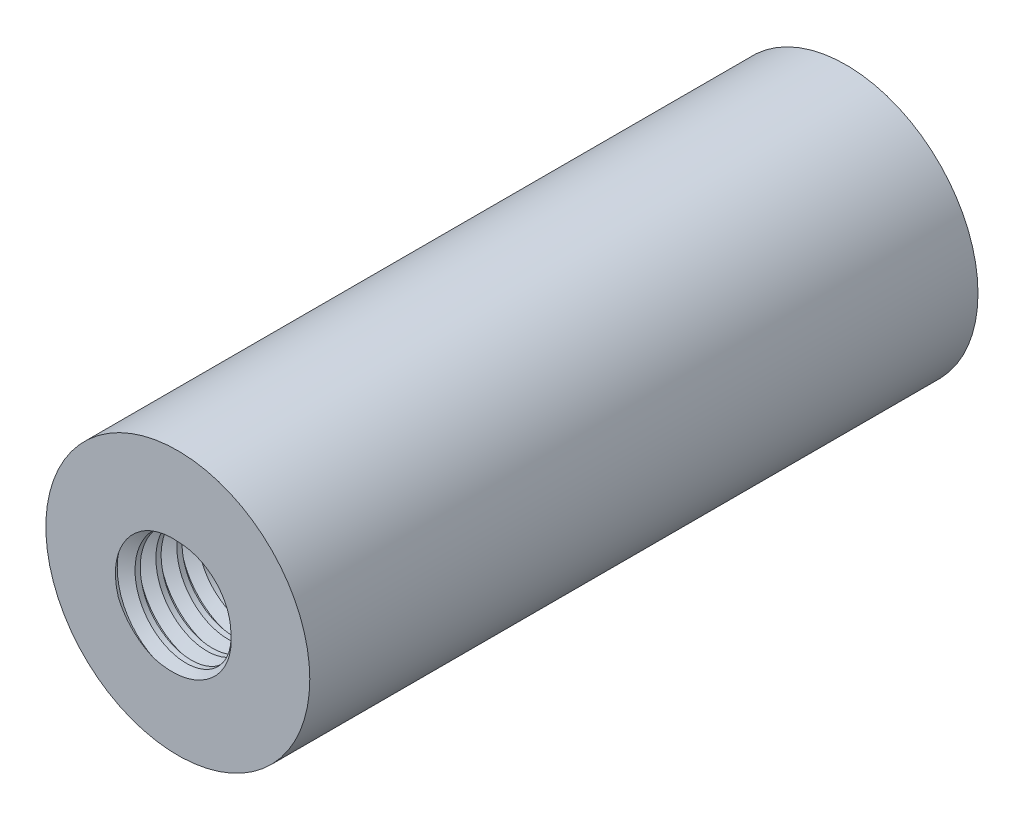
from build123d import *
from build123d.topology import SkipClean

# Parameters (mm, degrees)
SKETCH1_R           = 5.0165
BOSS_EXTRUDE1_DEPTH = 25.4
SKETCH2_R           = 2.0193
CUT_EXTRUDE1_DEPTH  = 27.372154719
THREAD1_PITCH       = 0.79375


with BuildPart() as part:
    # Sketch1 → Boss-Extrude1 (new body)
    with BuildSketch(Plane.XY):
        Circle(SKETCH1_R)
    extrude(amount=BOSS_EXTRUDE1_DEPTH)

    # Sketch2 → Cut-Extrude1 (cut, through all)
    with BuildSketch(Plane(origin=(0, 0, 0), x_dir=(-1, 0, 0), z_dir=(0, 0, -1))):
        Circle(SKETCH2_R)
    extrude(amount=-CUT_EXTRUDE1_DEPTH, mode=Mode.SUBTRACT)

    # Thread1: the profile of Thread Profile1 profile screwed along a right-hand helix of 32 turns, 8 arcs to a turn; built about Z, then put on its axis
    with SkipClean():  # the faces are left unmerged after this step: merging them gives an invalid solid
        thread1_z = Axis((0, 0, 0), (0, 0, 1))
        thread1_corners = [(2.019, 0, -0.000173205), (2.448929788, 0, 0.248046874), (2.448929788, 0, 0.347265624), (2.019, 0, 0.595485703)]
        with BuildLine(mode=Mode.PRIVATE) as thread1_profile:
            Line(thread1_corners[0], thread1_corners[1])
            Line(thread1_corners[1], thread1_corners[2])
            Line(thread1_corners[2], thread1_corners[3])
            Line(thread1_corners[3], thread1_corners[0])
        thread1_cap = Face(thread1_profile.wire())
        thread1_turn_angles = [0, 22.5, 45, 67.5, 90, 112.5, 135, 157.5, 180, 202.5, 225, 247.5, 270, 292.5, 315, 337.5, 360]
        thread1_turn_weights = [1, 0.9238795325112867, 1, 0.9238795325112867, 1, 0.9238795325112867, 1, 0.9238795325112867, 1, 0.9238795325112867, 1, 0.9238795325112867, 1, 0.9238795325112867, 1, 0.9238795325112867, 1]
        thread1_turn_rails = [Edge.make_bspline([Vector(p[0], p[1], 0).rotate(thread1_z, thread1_turn_angles[k]) / thread1_turn_weights[k] + Vector(0, 0, p[2] + THREAD1_PITCH * thread1_turn_angles[k] / 360) for k in range(17)], [0, 0, 0, 1, 1, 2, 2, 3, 3, 4, 4, 5, 5, 6, 6, 7, 7, 8, 8, 8], 2, thread1_turn_weights) for p in thread1_corners]
        thread1_turn_sides = [Face.make_surface_from_curves(thread1_turn_rails[p[0]], thread1_turn_rails[p[1]]) for p in [(0, 1), (1, 2), (2, 3), (3, 0)]]
        thread1 = Plane(origin=(0, 0, 0), x_dir=(1, 0, 0), z_dir=(0, 0, 1)) * Solid(Shell([*[p.moved(Location((0, 0, THREAD1_PITCH * i))) for i in range(32) for p in thread1_turn_sides], thread1_cap, thread1_cap.rotate(thread1_z, 11520).moved(Location((0, 0, THREAD1_PITCH * 11520 / 360)))]))
        add(thread1, mode=Mode.SUBTRACT)


solid = part.part
